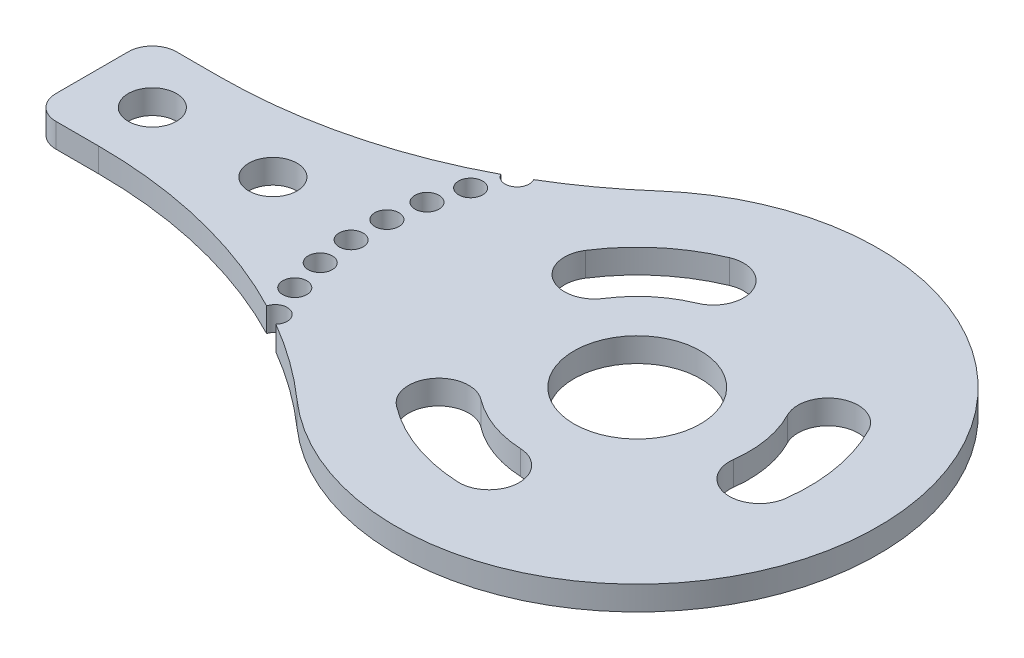
from build123d import *

# Parameters (mm, degrees)
EXTRUDE_1_DEPTH          = 2
SKETCH_2_R               = 1
CUT_EXTRUDE_1_DEPTH      = 70.884123245
PATTERN_CIRCULAR_1_COUNT = 8
PATTERN_CIRCULAR_1_ANGLE = 52.5
SKETCH_3_R               = 2
CUT_EXTRUDE_2_DEPTH      = 70.884123245
PATTERN_LINEAR_1_COUNT   = 2
PATTERN_LINEAR_1_PITCH   = 10
CUT_EXTRUDE_4_DEPTH      = 70.884123245
PATTERN_CIRCULAR_3_COUNT = 3
SKETCH_7_R               = 5.25
CUT_EXTRUDE_5_DEPTH      = 70.884123245


with BuildPart() as part:
    # Эскиз1 → Бобышка-Вытянуть1 (new body)
    with BuildSketch(Plane(origin=(0, 0, 0), x_dir=(1, 0, 0), z_dir=(0, 1, 0))):
        with BuildLine():
            Line((0, -2), (0, -8))
            ThreePointArc((0, -8), (0.585786438, -9.414213562), (2, -10))
            Line((2, -10), (5.542486889, -10))
            ThreePointArc((5.542486889, -10), (19.684622513, -12.583426132), (32, -20))
            ThreePointArc((32, -20), (65.228756555, -5), (32, 10))
            ThreePointArc((32, 10), (19.684622513, 2.583426132), (5.542486889, 0))
            Line((5.542486889, 0), (2, 0))
            ThreePointArc((2, 0), (0.585786438, -0.585786438), (0, -2))
        make_face()
    extrude(amount=EXTRUDE_1_DEPTH)

    # Эскиз2 → Вырез-Вытянуть1 (cut, through all)
    with BuildSketch(Plane(origin=(0, 2, 0), x_dir=(1, 0, 0), z_dir=(0, 1, 0))):
        with Locations((25.137189268, 5.128125392)):
            Circle(SKETCH_2_R)
    cut_extrude_1 = extrude(amount=-CUT_EXTRUDE_1_DEPTH, mode=Mode.SUBTRACT)

    # Круговой массив1: Вырез-Вытянуть1 ×8 about axis
    pattern_circular_1_axis = Axis((45.228756555, 2, 5), (0, 1, 0))
    for i in range(1, PATTERN_CIRCULAR_1_COUNT):
        add(cut_extrude_1.rotate(pattern_circular_1_axis, i * PATTERN_CIRCULAR_1_ANGLE / (PATTERN_CIRCULAR_1_COUNT - 1)), mode=Mode.SUBTRACT)

    # Эскиз3 → Вырез-Вытянуть2 (cut, through all)
    with BuildSketch(Plane(origin=(0, 2, 0), x_dir=(1, 0, 0), z_dir=(0, 1, 0))):
        with Locations((5, -5)):
            Circle(SKETCH_3_R)
    cut_extrude_2 = extrude(amount=-CUT_EXTRUDE_2_DEPTH, mode=Mode.SUBTRACT)

    # Линейный массив1: Вырез-Вытянуть2 ×2
    with Locations(*[(i * PATTERN_LINEAR_1_PITCH, 0, 0) for i in range(1, PATTERN_LINEAR_1_COUNT)]):
        add(cut_extrude_2, mode=Mode.SUBTRACT)

    # Эскиз6 → Вырез-Вытянуть4 (cut, through all)
    with BuildSketch(Plane(origin=(0, 2, 0), x_dir=(1, 0, 0), z_dir=(0, 1, 0))):
        with BuildLine():
            ThreePointArc((37.446222009, -0.000750623), (39.288664725, 2.090532233), (41.67041088, 3.538062681))
            ThreePointArc((41.67041088, 3.538062681), (43.016297342, 6.807403537), (39.746956487, 8.153289999))
            ThreePointArc((39.746956487, 8.153289999), (36.077763715, 5.923300776), (33.239393437, 2.701580475))
            ThreePointArc((33.239393437, 2.701580475), (33.991642174, -0.75299936), (37.446222009, -0.000750623))
        make_face()
    cut_extrude_4 = extrude(amount=-CUT_EXTRUDE_4_DEPTH, mode=Mode.SUBTRACT)

    # Круговой массив3: Вырез-Вытянуть4 ×3 about axis
    pattern_circular_3_axis = Axis((45.228756555, 2, 5), (0, 1, 0))
    for i in range(1, PATTERN_CIRCULAR_3_COUNT):
        add(cut_extrude_4.rotate(pattern_circular_3_axis, i * 360 / PATTERN_CIRCULAR_3_COUNT), mode=Mode.SUBTRACT)

    # Эскиз7 → Вырез-Вытянуть5 (cut, through all)
    with BuildSketch(Plane(origin=(0, 2, 0), x_dir=(1, 0, 0), z_dir=(0, 1, 0))):
        with Locations((45.228756555, -5)):
            Circle(SKETCH_7_R)
    extrude(amount=-CUT_EXTRUDE_5_DEPTH, mode=Mode.SUBTRACT)


solid = part.part
